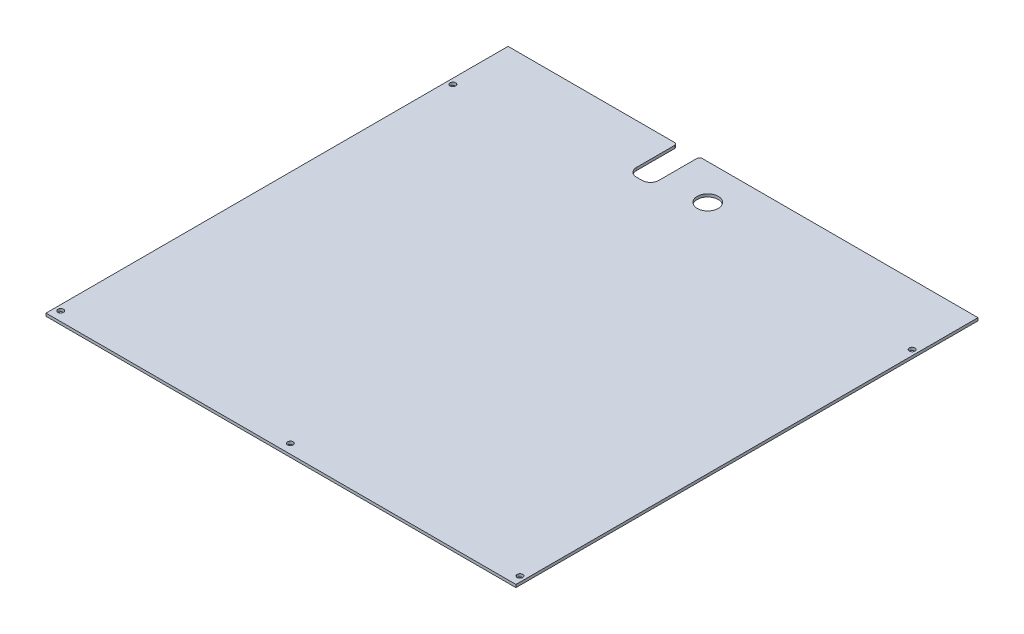
from build123d import *

# Parameters (mm, degrees)
CROQUIS12_W           = 335
CROQUIS12_H           = 329.4
BRIDA_BASE2_DEPTH     = 2
CORTAR_EXTRUIR6_REACH = 269.058
CROQUIS27_R           = 2
CORTAR_EXTRUIR7_REACH = 269.058
CROQUIS28_R           = 7.5
CROQUIS29_W           = 16
CROQUIS29_H           = 35
CORTAR_EXTRUIR8_DEPTH = 268.058214815
REDONDEO1_R           = 6
REDONDEO2_R           = 2


# Sheet-metal steps are written as plain solids
with BuildPart() as part:
    # Croquis12 → Brida base2 (new body)
    with BuildSketch(Plane(origin=(0, 0, 0), x_dir=(1, 0, 0), z_dir=(0, 1, 0))):
        with Locations((0, -43.29)):
            Rectangle(CROQUIS12_W, CROQUIS12_H)
    extrude(amount=-BRIDA_BASE2_DEPTH)

    # Croquis27 → Cortar-Extruir6 (cut, up to next)
    with BuildSketch(Plane(origin=(0, 0, 0), x_dir=(1, 0, 0), z_dir=(0, 1, 0)), mode=Mode.PRIVATE) as cortar_extruir6_sk1:
        with Locations(Location((-163.7, -201.3, 0), (0, 0, 270))):
            Circle(CROQUIS27_R)
    cortar_extruir6_tool1 = extrude(cortar_extruir6_sk1.sketch, amount=-CORTAR_EXTRUIR6_REACH, mode=Mode.PRIVATE) & part.part
    # Croquis27 → Cortar-Extruir6 (cut, up to next)
    with BuildSketch(Plane(origin=(0, 0, 0), x_dir=(1, 0, 0), z_dir=(0, 1, 0)), mode=Mode.PRIVATE) as cortar_extruir6_sk2:
        with Locations(Location((-163.7, 78.26, 0), (0, 0, 270))):
            Circle(CROQUIS27_R)
    cortar_extruir6_tool2 = extrude(cortar_extruir6_sk2.sketch, amount=-CORTAR_EXTRUIR6_REACH, mode=Mode.PRIVATE) & part.part
    # Croquis27 → Cortar-Extruir6 (cut, up to next)
    with BuildSketch(Plane(origin=(0, 0, 0), x_dir=(1, 0, 0), z_dir=(0, 1, 0)), mode=Mode.PRIVATE) as cortar_extruir6_sk3:
        with Locations(Location((163.7, 78.26, 0), (0, 0, 90))):
            Circle(CROQUIS27_R)
    cortar_extruir6_tool3 = extrude(cortar_extruir6_sk3.sketch, amount=-CORTAR_EXTRUIR6_REACH, mode=Mode.PRIVATE) & part.part
    # Croquis27 → Cortar-Extruir6 (cut, up to next)
    with BuildSketch(Plane(origin=(0, 0, 0), x_dir=(1, 0, 0), z_dir=(0, 1, 0)), mode=Mode.PRIVATE) as cortar_extruir6_sk4:
        with Locations(Location((163.7, -201.3, 0), (0, 0, 90))):
            Circle(CROQUIS27_R)
    cortar_extruir6_tool4 = extrude(cortar_extruir6_sk4.sketch, amount=-CORTAR_EXTRUIR6_REACH, mode=Mode.PRIVATE) & part.part
    # Croquis27 → Cortar-Extruir6 (cut, up to next)
    with BuildSketch(Plane(origin=(0, 0, 0), x_dir=(1, 0, 0), z_dir=(0, 1, 0)), mode=Mode.PRIVATE) as cortar_extruir6_sk5:
        with Locations(Location((0, -201.3, 0), (0, 0, 270))):
            Circle(CROQUIS27_R)
    cortar_extruir6_tool5 = extrude(cortar_extruir6_sk5.sketch, amount=-CORTAR_EXTRUIR6_REACH, mode=Mode.PRIVATE) & part.part
    add(cortar_extruir6_tool1.solids().sort_by_distance((-163.7, 0, 201.3))[0], mode=Mode.SUBTRACT)
    add(cortar_extruir6_tool2.solids().sort_by_distance((-163.7, 0, -78.26))[0], mode=Mode.SUBTRACT)
    add(cortar_extruir6_tool3.solids().sort_by_distance((163.7, 0, -78.26))[0], mode=Mode.SUBTRACT)
    add(cortar_extruir6_tool4.solids().sort_by_distance((163.7, 0, 201.3))[0], mode=Mode.SUBTRACT)
    add(cortar_extruir6_tool5.solids().sort_by_distance((0, 0, 201.3))[0], mode=Mode.SUBTRACT)

    # Croquis28 → Cortar-Extruir7 (cut, up to next)
    with BuildSketch(Plane(origin=(0, 0, 0), x_dir=(1, 0, 0), z_dir=(0, 1, 0)), mode=Mode.PRIVATE) as cortar_extruir7_sk1:
        with Locations(Location((0, 96.25, 0), (0, 0, 270))):
            Circle(CROQUIS28_R)
    cortar_extruir7_tool1 = extrude(cortar_extruir7_sk1.sketch, amount=-CORTAR_EXTRUIR7_REACH, mode=Mode.PRIVATE) & part.part
    add(cortar_extruir7_tool1.solids().sort_by_distance((0, 0, -96.25))[0], mode=Mode.SUBTRACT)

    # Croquis29 → Cortar-Extruir8 (cut, through all)
    with BuildSketch(Plane(origin=(0, 0, 0), x_dir=(1, 0, 0), z_dir=(0, 1, 0))):
        with Locations((-39, 103.91)):
            Rectangle(CROQUIS29_W, CROQUIS29_H)
    extrude(amount=-CORTAR_EXTRUIR8_DEPTH, mode=Mode.SUBTRACT)

    # Redondeo1
    redondeo1_edges = [part.edges().sort_by_distance(p)[0] for p in [
        (-47, -1, -86.41),
        (-31, -1, -86.41),
    ]]
    fillet(redondeo1_edges, radius=REDONDEO1_R)

    # Redondeo2
    redondeo2_edges = [part.edges().sort_by_distance(p)[0] for p in [
        (-47, -1, -121.41),
        (-31, -1, -121.41),
    ]]
    fillet(redondeo2_edges, radius=REDONDEO2_R)


solid = part.part
